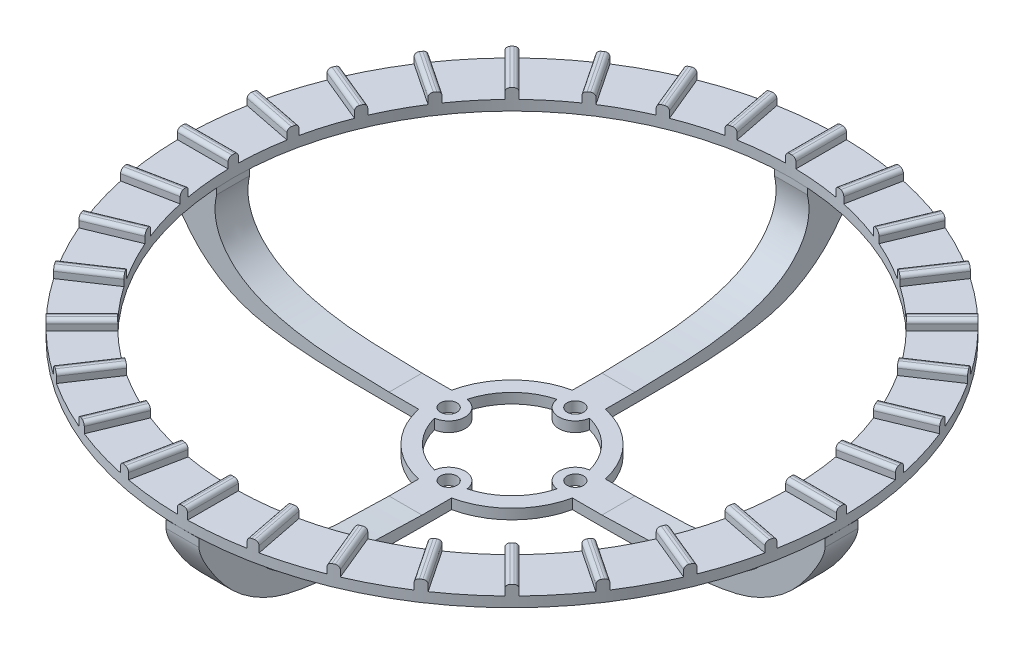
from build123d import *
from build123d.topology import SkipClean

# Parameters (mm, degrees)
SKETCH1_R                = 65
SKETCH1_R_2              = 55
BOSS_EXTRUDE1_DEPTH      = 2
BOSS_EXTRUDE3_DEPTH      = 2
FILLET1_R                = 0.75
CIRPATTERN1_COUNT        = 32
FILLET1_OF_CIRPATTERN1_R = 0.75
SKETCH4_R                = 3.25
SKETCH4_R_2              = 1.625
BOSS_EXTRUDE4_DEPTH      = 2
CIRPATTERN9_COUNT        = 4
BOSS_EXTRUDE5_DEPTH      = 3.25
CIRPATTERN7_COUNT        = 4
SKETCH7_R                = 15.5
SKETCH7_R_2              = 12.5
BOSS_EXTRUDE6_DEPTH      = 2
SKETCH6_R                = 1.625
CUT_EXTRUDE2_DEPTH       = 4


with BuildPart() as part:
    # Sketch1 → Boss-Extrude1 (new body)
    with BuildSketch(Plane(origin=(0, 0, 0), x_dir=(1, 0, 0), z_dir=(0, 1, 0))):
        with Locations(Location((0, 0, 0), (0, 0, 270))):
            Circle(SKETCH1_R)
        with Locations(Location((0, 0, 0), (0, 0, 270))):
            Circle(SKETCH1_R_2, mode=Mode.SUBTRACT)
    extrude(amount=BOSS_EXTRUDE1_DEPTH)

    # Sketch2 → Boss-Extrude3 (add)
    with SkipClean():  # the faces are left unmerged after this step: merging them gives an invalid solid
        with BuildSketch(Plane(origin=(0, 2, 0), x_dir=(1, 0, 0), z_dir=(0, 1, 0))):
            with BuildLine():
                Line((-1, 64.992307237), (-1, 54.990908339))
                ThreePointArc((-1, 54.990908339), (0, 55), (1, 54.990908339))
                Line((1, 54.990908339), (1, 64.992307237))
                ThreePointArc((1, 64.992307237), (0, 65), (-1, 64.992307237))
            make_face()
        boss_extrude3 = extrude(amount=BOSS_EXTRUDE3_DEPTH)

    # Fillet1
    fillet1_edges = [part.edges().sort_by_distance(p)[0] for p in [
        (-1, 4, -59.991607788),
        (1, 4, -59.991607788),
    ]]
    fillet(fillet1_edges, radius=FILLET1_R)

    # CirPattern1: Boss-Extrude3 ×32 about axis
    with SkipClean():  # the faces are left unmerged after this step: merging them gives an invalid solid
        cirpattern1_axis = Axis((0, 0, 0), (0, 1, 0))
        for i in range(1, CIRPATTERN1_COUNT):
            add(boss_extrude3.rotate(cirpattern1_axis, i * 360 / CIRPATTERN1_COUNT))

    # Fillet1 of CirPattern1
    fillet1_of_cirpattern1_edges = [part.edges().sort_by_distance(p)[0] for p in [
        (-12.684567362, 4, -58.643795544),
        (-10.722996801, 4, -59.033976188),
        (-23.881673914, 4, -55.042335126),
        (-22.033914849, 4, -55.80770199),
        (-34.16102113, 4, -49.325628636),
        (-32.498081906, 4, -50.436769102),
        (-43.127579463, 4, -41.7133659),
        (-41.7133659, 4, -43.127579463),
        (-50.436769102, 4, -32.498081906),
        (-49.325628636, 4, -34.16102113),
        (-55.80770199, 4, -22.033914849),
        (-55.042335126, 4, -23.881673914),
        (-59.033976188, 4, -10.722996801),
        (-58.643795544, 4, -12.684567362),
        (-59.991607788, 4, 1),
        (-59.991607788, 4, -1),
        (-58.643795544, 4, 12.684567362),
        (-59.033976188, 4, 10.722996801),
        (-55.042335126, 4, 23.881673914),
        (-55.80770199, 4, 22.033914849),
        (-49.325628636, 4, 34.16102113),
        (-50.436769102, 4, 32.498081906),
        (-41.7133659, 4, 43.127579463),
        (-43.127579463, 4, 41.7133659),
        (-32.498081906, 4, 50.436769102),
        (-34.16102113, 4, 49.325628636),
        (-22.033914849, 4, 55.80770199),
        (-23.881673914, 4, 55.042335126),
        (-10.722996801, 4, 59.033976188),
        (-12.684567362, 4, 58.643795544),
        (1, 4, 59.991607788),
        (-1, 4, 59.991607788),
        (12.684567362, 4, 58.643795544),
        (10.722996801, 4, 59.033976188),
        (23.881673914, 4, 55.042335126),
        (22.033914849, 4, 55.80770199),
        (34.16102113, 4, 49.325628636),
        (32.498081906, 4, 50.436769102),
        (43.127579463, 4, 41.7133659),
        (41.7133659, 4, 43.127579463),
        (50.436769102, 4, 32.498081906),
        (49.325628636, 4, 34.16102113),
        (55.80770199, 4, 22.033914849),
        (55.042335126, 4, 23.881673914),
        (59.033976188, 4, 10.722996801),
        (58.643795544, 4, 12.684567362),
        (59.991607788, 4, -1),
        (59.991607788, 4, 1),
        (58.643795544, 4, -12.684567362),
        (59.033976188, 4, -10.722996801),
        (55.042335126, 4, -23.881673914),
        (55.80770199, 4, -22.033914849),
        (49.325628636, 4, -34.16102113),
        (50.436769102, 4, -32.498081906),
        (41.7133659, 4, -43.127579463),
        (43.127579463, 4, -41.7133659),
        (32.498081906, 4, -50.436769102),
        (34.16102113, 4, -49.325628636),
        (22.033914849, 4, -55.80770199),
        (23.881673914, 4, -55.042335126),
        (10.722996801, 4, -59.033976188),
        (12.684567362, 4, -58.643795544),
    ]]
    fillet(fillet1_of_cirpattern1_edges, radius=FILLET1_OF_CIRPATTERN1_R)



with BuildPart() as body_2:
    # Sketch4 → Boss-Extrude4 (new body)
    with BuildSketch(Plane(origin=(0, -18, 0), x_dir=(1, 0, 0), z_dir=(0, 1, 0))):
        with Locations(Location((-12.5, 0, 0), (0, 0, 270))):
            Circle(SKETCH4_R)
        with Locations(Location((-12.5, 0, 0), (0, 0, 270))):
            Circle(SKETCH4_R_2, mode=Mode.SUBTRACT)
    extrude(amount=-BOSS_EXTRUDE4_DEPTH)


with BuildPart() as cirpattern9_1:
    # CirPattern9: pattern copy
    add(body_2.part.rotate(Axis((0, 0, 0), (0, 1, 0)), 1 * 360 / CIRPATTERN9_COUNT))


with BuildPart() as cirpattern9_2:
    # CirPattern9: pattern copy
    add(body_2.part.rotate(Axis((0, 0, 0), (0, 1, 0)), 2 * 360 / CIRPATTERN9_COUNT))


with BuildPart() as cirpattern9_3:
    # CirPattern9: pattern copy
    add(body_2.part.rotate(Axis((0, 0, 0), (0, 1, 0)), 3 * 360 / CIRPATTERN9_COUNT))


with BuildPart() as part_1:
    add(part.part)

    add(body_2.part)  # Boss-Extrude5 merges body 2
    # Sketch5 → Boss-Extrude5 (add, symmetric)
    with BuildSketch(Plane.XY):
        with BuildLine():
            Line((-12.084198026, -18), (-21.000867974, -18))
            add(Edge.make_bspline(
                [(-55, -1.272628549), (-56.299313106, -6.359770507), (-52.286736032, -12.658359055), (-38.695997324, -17.962449496), (-28.53662842, -17.780632672), (-21.000867974, -18)],
                knots=[0, 0, 0, 0, 0.305756853, 0.470346605, 1, 1, 1, 1], degree=3))
            Line((-55, -1.272628549), (-55, 0))
            Line((-55, 0), (-65, 0))
            Line((-65, 0), (-65, -1.525041691))
            add(Edge.make_bspline(
                [(-65, -1.525041691), (-64.946683006, -2.928090468), (-60.765818071, -10.542070911), (-53.1697835, -16.726467778), (-45.257091079, -19.078428123), (-33.605361947, -20.06797325), (-21.000867974, -20)],
                knots=[0, 0, 0, 0, 0.088913557, 0.316962935, 0.647005877, 1, 1, 1, 1], degree=3))
            Line((-21.000867974, -20), (-12.084198026, -20))
            Line((-12.084198026, -20), (-12.084198026, -18))
        make_face()
    boss_extrude5 = extrude(amount=BOSS_EXTRUDE5_DEPTH, both=True)

    # CirPattern7: Boss-Extrude5 ×4 about axis
    cirpattern7_axis = Axis((0, 2, 0), (0, -1, 0))
    for i in range(1, CIRPATTERN7_COUNT):
        add(boss_extrude5.rotate(cirpattern7_axis, i * 360 / CIRPATTERN7_COUNT))


with BuildPart() as cirpattern9_3_1:
    add(cirpattern9_3.part)

    # Combine1: union CirPattern9_2, CirPattern9_1, part
    add(cirpattern9_2.part)
    add(cirpattern9_1.part)
    add(part_1.part)

    # Sketch7 → Boss-Extrude6 (add)
    with SkipClean():  # the faces are left unmerged after this step: merging them gives an invalid solid
        with BuildSketch(Plane(origin=(0, -18, 0), x_dir=(1, 0, 0), z_dir=(0, 1, 0))):
            Circle(SKETCH7_R)
            Circle(SKETCH7_R_2, mode=Mode.SUBTRACT)
        extrude(amount=-BOSS_EXTRUDE6_DEPTH)

    # Sketch6 → Cut-Extrude2 (cut)
    with SkipClean():  # the faces are left unmerged after this step: merging them gives an invalid solid
        with BuildSketch(Plane(origin=(0, -18, 0), x_dir=(1, 0, 0), z_dir=(0, 1, 0))):
            with Locations(Location((-12.5, 0, 0), (0, 0, 270))):
                Circle(SKETCH6_R)
            with Locations(Location((0, 12.5, 0), (0, 0, 180))):
                Circle(SKETCH6_R)
            with Locations(Location((12.5, 0, 0), (0, 0, 90))):
                Circle(SKETCH6_R)
            with Locations((0, -12.5)):
                Circle(SKETCH6_R)
        extrude(amount=-CUT_EXTRUDE2_DEPTH, mode=Mode.SUBTRACT)


solid = cirpattern9_3_1.part
